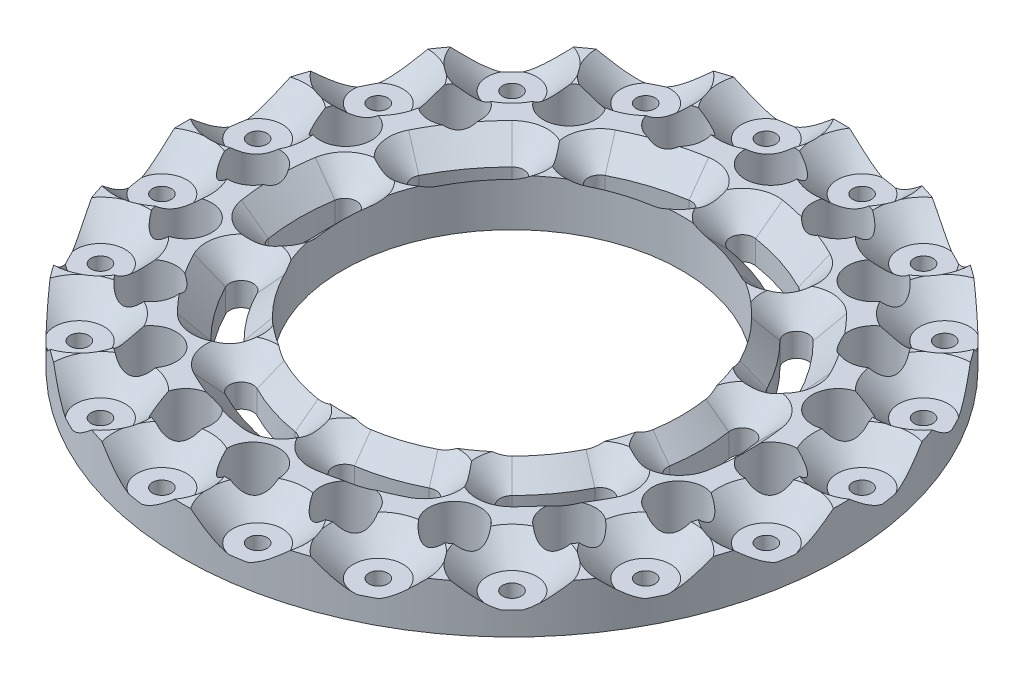
from build123d import *

# Parameters (mm, degrees)
SKETCH1_R           = 70
SKETCH1_R_2         = 5.5
SKETCH1_R_3         = 36
SKETCH1_R_4         = 2
BOSS_EXTRUDE1_DEPTH = 10
SKETCH3_R           = 5.25
CUT_EXTRUDE3_DEPTH  = 5
CHAMFER2_SIZE       = 5
CUT_EXTRUDE4_DEPTH  = 100.498743861
CHAMFER3_SIZE       = 5


with BuildPart() as part:
    # Sketch1 → Boss-Extrude1 (new body)
    with BuildSketch(Plane(origin=(0, 0, 0), x_dir=(1, 0, 0), z_dir=(0, 1, 0))):
        with Locations(Location((0, 0, 0), (0, 0, 270))):
            Circle(SKETCH1_R)
        with Locations(Location((55, 0, 0), (0, 0, 270))):
            Circle(SKETCH1_R_2, mode=Mode.SUBTRACT)
        with Locations(Location((52.308108396, -16.995934691, 0), (0, 0, 270))):
            Circle(SKETCH1_R_2, mode=Mode.SUBTRACT)
        with Locations(Location((44.495934691, -32.328188876, 0), (0, 0, 270))):
            Circle(SKETCH1_R_2, mode=Mode.SUBTRACT)
        with Locations(Location((32.328188876, -44.495934691, 0), (0, 0, 270))):
            Circle(SKETCH1_R_2, mode=Mode.SUBTRACT)
        with Locations(Location((16.995934691, -52.308108396, 0), (0, 0, 270))):
            Circle(SKETCH1_R_2, mode=Mode.SUBTRACT)
        with Locations(Location((0, -55, 0), (0, 0, 270))):
            Circle(SKETCH1_R_2, mode=Mode.SUBTRACT)
        with Locations(Location((-16.995934691, -52.308108396, 0), (0, 0, 270))):
            Circle(SKETCH1_R_2, mode=Mode.SUBTRACT)
        with Locations(Location((-32.328188876, -44.495934691, 0), (0, 0, 270))):
            Circle(SKETCH1_R_2, mode=Mode.SUBTRACT)
        with Locations(Location((-44.495934691, -32.328188876, 0), (0, 0, 270))):
            Circle(SKETCH1_R_2, mode=Mode.SUBTRACT)
        with Locations(Location((-52.308108396, -16.995934691, 0), (0, 0, 270))):
            Circle(SKETCH1_R_2, mode=Mode.SUBTRACT)
        with Locations(Location((-55, 0, 0), (0, 0, 270))):
            Circle(SKETCH1_R_2, mode=Mode.SUBTRACT)
        with Locations(Location((-52.308108396, 16.995934691, 0), (0, 0, 270))):
            Circle(SKETCH1_R_2, mode=Mode.SUBTRACT)
        with Locations(Location((-44.495934691, 32.328188876, 0), (0, 0, 270))):
            Circle(SKETCH1_R_2, mode=Mode.SUBTRACT)
        with Locations(Location((-32.328188876, 44.495934691, 0), (0, 0, 270))):
            Circle(SKETCH1_R_2, mode=Mode.SUBTRACT)
        with Locations(Location((-16.995934691, 52.308108396, 0), (0, 0, 270))):
            Circle(SKETCH1_R_2, mode=Mode.SUBTRACT)
        with Locations(Location((0, 55, 0), (0, 0, 270))):
            Circle(SKETCH1_R_2, mode=Mode.SUBTRACT)
        with Locations(Location((16.995934691, 52.308108396, 0), (0, 0, 270))):
            Circle(SKETCH1_R_2, mode=Mode.SUBTRACT)
        with Locations(Location((32.328188876, 44.495934691, 0), (0, 0, 270))):
            Circle(SKETCH1_R_2, mode=Mode.SUBTRACT)
        with Locations(Location((44.495934691, 32.328188876, 0), (0, 0, 270))):
            Circle(SKETCH1_R_2, mode=Mode.SUBTRACT)
        with Locations(Location((52.308108396, 16.995934691, 0), (0, 0, 270))):
            Circle(SKETCH1_R_2, mode=Mode.SUBTRACT)
        with Locations(Location((0, 0, 0), (0, 0, 270))):
            Circle(SKETCH1_R_3, mode=Mode.SUBTRACT)
        with Locations(Location((64.199742139, 10.168240228, 0), (0, 0, 270))):
            Circle(SKETCH1_R_4, mode=Mode.SUBTRACT)
        with Locations(Location((64.199742139, -10.168240228, 0), (0, 0, 270))):
            Circle(SKETCH1_R_4, mode=Mode.SUBTRACT)
        with Locations(Location((57.915424072, -29.509382483, 0), (0, 0, 270))):
            Circle(SKETCH1_R_4, mode=Mode.SUBTRACT)
        with Locations(Location((45.961940777, -45.961940777, 0), (0, 0, 270))):
            Circle(SKETCH1_R_4, mode=Mode.SUBTRACT)
        with Locations(Location((29.509382483, -57.915424072, 0), (0, 0, 270))):
            Circle(SKETCH1_R_4, mode=Mode.SUBTRACT)
        with Locations(Location((10.168240228, -64.199742139, 0), (0, 0, 270))):
            Circle(SKETCH1_R_4, mode=Mode.SUBTRACT)
        with Locations(Location((-10.168240228, -64.199742139, 0), (0, 0, 270))):
            Circle(SKETCH1_R_4, mode=Mode.SUBTRACT)
        with Locations(Location((-29.509382483, -57.915424072, 0), (0, 0, 270))):
            Circle(SKETCH1_R_4, mode=Mode.SUBTRACT)
        with Locations(Location((-45.961940777, -45.961940777, 0), (0, 0, 270))):
            Circle(SKETCH1_R_4, mode=Mode.SUBTRACT)
        with Locations(Location((-57.915424072, -29.509382483, 0), (0, 0, 270))):
            Circle(SKETCH1_R_4, mode=Mode.SUBTRACT)
        with Locations(Location((-64.199742139, -10.168240228, 0), (0, 0, 270))):
            Circle(SKETCH1_R_4, mode=Mode.SUBTRACT)
        with Locations(Location((-64.199742139, 10.168240228, 0), (0, 0, 270))):
            Circle(SKETCH1_R_4, mode=Mode.SUBTRACT)
        with Locations(Location((-57.915424072, 29.509382483, 0), (0, 0, 270))):
            Circle(SKETCH1_R_4, mode=Mode.SUBTRACT)
        with Locations(Location((-45.961940777, 45.961940777, 0), (0, 0, 270))):
            Circle(SKETCH1_R_4, mode=Mode.SUBTRACT)
        with Locations(Location((-29.509382483, 57.915424072, 0), (0, 0, 270))):
            Circle(SKETCH1_R_4, mode=Mode.SUBTRACT)
        with Locations(Location((-10.168240228, 64.199742139, 0), (0, 0, 270))):
            Circle(SKETCH1_R_4, mode=Mode.SUBTRACT)
        with Locations(Location((10.168240228, 64.199742139, 0), (0, 0, 270))):
            Circle(SKETCH1_R_4, mode=Mode.SUBTRACT)
        with Locations(Location((29.509382483, 57.915424072, 0), (0, 0, 270))):
            Circle(SKETCH1_R_4, mode=Mode.SUBTRACT)
        with Locations(Location((45.961940777, 45.961940777, 0), (0, 0, 270))):
            Circle(SKETCH1_R_4, mode=Mode.SUBTRACT)
        with Locations(Location((57.915424072, 29.509382483, 0), (0, 0, 270))):
            Circle(SKETCH1_R_4, mode=Mode.SUBTRACT)
    extrude(amount=BOSS_EXTRUDE1_DEPTH)

    # Sketch3 → Cut-Extrude3 (cut)
    with BuildSketch(Plane(origin=(0, 10, 0), x_dir=(1, 0, 0), z_dir=(0, 1, 0))):
        with Locations((-57.915424072, -29.509382483)):
            Circle(SKETCH3_R)
        with Locations((-64.199742139, -10.168240228)):
            Circle(SKETCH3_R)
        with Locations((-64.199742139, 10.168240228)):
            Circle(SKETCH3_R)
        with Locations((-57.915424072, 29.509382483)):
            Circle(SKETCH3_R)
        with Locations((-45.961940777, 45.961940777)):
            Circle(SKETCH3_R)
        with Locations((-29.509382483, 57.915424072)):
            Circle(SKETCH3_R)
        with Locations((-10.168240228, 64.199742139)):
            Circle(SKETCH3_R)
        with Locations((10.168240228, 64.199742139)):
            Circle(SKETCH3_R)
        with Locations((29.509382483, 57.915424072)):
            Circle(SKETCH3_R)
        with Locations((45.961940777, 45.961940777)):
            Circle(SKETCH3_R)
        with Locations((57.915424072, 29.509382483)):
            Circle(SKETCH3_R)
        with Locations((64.199742139, 10.168240228)):
            Circle(SKETCH3_R)
        with Locations((64.199742139, -10.168240228)):
            Circle(SKETCH3_R)
        with Locations((57.915424072, -29.509382483)):
            Circle(SKETCH3_R)
        with Locations((45.961940777, -45.961940777)):
            Circle(SKETCH3_R)
        with Locations((29.509382483, -57.915424072)):
            Circle(SKETCH3_R)
        with Locations((10.168240228, -64.199742139)):
            Circle(SKETCH3_R)
        with Locations((-10.168240228, -64.199742139)):
            Circle(SKETCH3_R)
        with Locations((-29.509382483, -57.915424072)):
            Circle(SKETCH3_R)
        with Locations((-45.961940777, -45.961940777)):
            Circle(SKETCH3_R)
    extrude(amount=-CUT_EXTRUDE3_DEPTH, mode=Mode.SUBTRACT)

    # Chamfer2
    # the kernel refuses this chamfer: 5 mm, written as the material it takes off along each edge
    with BuildSketch(Plane(origin=(-57.915424072, 10, 29.509382483), x_dir=(-0.8924283781234055, 0, 0.45118908444246325), z_dir=(0.45118908444246325, 0, 0.8924283781234055))) as chamfer2_piece_1_section:
        Polygon((5.25, CHAMFER2_SIZE), (5.25 + CHAMFER2_SIZE, 0), (5.25, 0), align=None)
    chamfer2_piece_1 = revolve(axis=Axis((-57.915424072, 10, 29.509382483), (0, -1, 0)), revolution_arc=359.64, mode=Mode.PRIVATE)
    chamfer2_piece_1 = split(chamfer2_piece_1, bisect_by=Plane(origin=(-51.000108994, 5, 25.985853459), z_dir=(0, 1, 0)), keep=Keep.TOP, mode=Mode.PRIVATE)
    add(chamfer2_piece_1, mode=Mode.SUBTRACT)
    with BuildSketch(Plane(origin=(-45.961940777, 10, 45.961940777), x_dir=(-0.7093247295722279, 0, 0.7048818539424077), z_dir=(0.7048818539424077, 0, 0.7093247295722279))) as chamfer2_piece_2_section:
        Polygon((5.25, CHAMFER2_SIZE), (5.25 + CHAMFER2_SIZE, 0), (5.25, 0), align=None)
    chamfer2_piece_2 = revolve(axis=Axis((-45.961940777, 10, 45.961940777), (0, -1, 0)), revolution_arc=359.64, mode=Mode.PRIVATE)
    chamfer2_piece_2 = split(chamfer2_piece_2, bisect_by=Plane(origin=(-40.473915658, 5, 40.473915658), z_dir=(0, 1, 0)), keep=Keep.TOP, mode=Mode.PRIVATE)
    add(chamfer2_piece_2, mode=Mode.SUBTRACT)
    with BuildSketch(Plane(origin=(-29.509382483, 10, 57.915424072), x_dir=(-0.45678743433478863, 0, 0.8895758763780868), z_dir=(0.8895758763780868, 0, 0.45678743433478863))) as chamfer2_piece_3_section:
        Polygon((5.25, CHAMFER2_SIZE), (5.25 + CHAMFER2_SIZE, 0), (5.25, 0), align=None)
    chamfer2_piece_3 = revolve(axis=Axis((-29.509382483, 10, 57.915424072), (0, -1, 0)), revolution_arc=359.64, mode=Mode.PRIVATE)
    chamfer2_piece_3 = split(chamfer2_piece_3, bisect_by=Plane(origin=(-25.985853459, 5, 51.000108994), z_dir=(0, 1, 0)), keep=Keep.TOP, mode=Mode.PRIVATE)
    add(chamfer2_piece_3, mode=Mode.SUBTRACT)
    with BuildSketch(Plane(origin=(-10.168240228, 10, 64.199742139), x_dir=(-0.15953660239825893, 0, 0.9871920139948559), z_dir=(0.9871920139948559, 0, 0.15953660239825893))) as chamfer2_piece_4_section:
        Polygon((5.25, CHAMFER2_SIZE), (5.25 + CHAMFER2_SIZE, 0), (5.25, 0), align=None)
    chamfer2_piece_4 = revolve(axis=Axis((-10.168240228, 10, 64.199742139), (0, -1, 0)), revolution_arc=359.64, mode=Mode.PRIVATE)
    chamfer2_piece_4 = split(chamfer2_piece_4, bisect_by=Plane(origin=(-8.95411487, 5, 56.534056322), z_dir=(0, 1, 0)), keep=Keep.TOP, mode=Mode.PRIVATE)
    add(chamfer2_piece_4, mode=Mode.SUBTRACT)
    with BuildSketch(Plane(origin=(10.168240228, 10, 64.199742139), x_dir=(0.15333078373687278, 0, 0.9881749191102942), z_dir=(0.9881749191102942, 0, -0.15333078373687278))) as chamfer2_piece_5_section:
        Polygon((5.25, CHAMFER2_SIZE), (5.25 + CHAMFER2_SIZE, 0), (5.25, 0), align=None)
    chamfer2_piece_5 = revolve(axis=Axis((10.168240228, 10, 64.199742139), (0, -1, 0)), revolution_arc=359.64, mode=Mode.PRIVATE)
    chamfer2_piece_5 = split(chamfer2_piece_5, bisect_by=Plane(origin=(8.95411487, 5, 56.534056323), z_dir=(0, 1, 0)), keep=Keep.TOP, mode=Mode.PRIVATE)
    add(chamfer2_piece_5, mode=Mode.SUBTRACT)
    with BuildSketch(Plane(origin=(29.509382483, 10, 57.915424072), x_dir=(0.45118908444246214, 0, 0.8924283781234059), z_dir=(0.8924283781234059, 0, -0.45118908444246214))) as chamfer2_piece_6_section:
        Polygon((5.25, CHAMFER2_SIZE), (5.25 + CHAMFER2_SIZE, 0), (5.25, 0), align=None)
    chamfer2_piece_6 = revolve(axis=Axis((29.509382483, 10, 57.915424072), (0, -1, 0)), revolution_arc=359.64, mode=Mode.PRIVATE)
    chamfer2_piece_6 = split(chamfer2_piece_6, bisect_by=Plane(origin=(25.985853459, 5, 51.000108994), z_dir=(0, 1, 0)), keep=Keep.TOP, mode=Mode.PRIVATE)
    add(chamfer2_piece_6, mode=Mode.SUBTRACT)
    with BuildSketch(Plane(origin=(45.961940777, 10, 45.961940777), x_dir=(0.7048818539424131, 0, 0.7093247295722225), z_dir=(0.7093247295722225, 0, -0.7048818539424131))) as chamfer2_piece_7_section:
        Polygon((5.25, CHAMFER2_SIZE), (5.25 + CHAMFER2_SIZE, 0), (5.25, 0), align=None)
    chamfer2_piece_7 = revolve(axis=Axis((45.961940777, 10, 45.961940777), (0, -1, 0)), revolution_arc=359.64, mode=Mode.PRIVATE)
    chamfer2_piece_7 = split(chamfer2_piece_7, bisect_by=Plane(origin=(40.473915658, 5, 40.473915658), z_dir=(0, 1, 0)), keep=Keep.TOP, mode=Mode.PRIVATE)
    add(chamfer2_piece_7, mode=Mode.SUBTRACT)
    with BuildSketch(Plane(origin=(57.915424072, 10, 29.509382483), x_dir=(0.8895758763780893, 0, 0.4567874343347838), z_dir=(0.4567874343347838, 0, -0.8895758763780893))) as chamfer2_piece_8_section:
        Polygon((5.25, CHAMFER2_SIZE), (5.25 + CHAMFER2_SIZE, 0), (5.25, 0), align=None)
    chamfer2_piece_8 = revolve(axis=Axis((57.915424072, 10, 29.509382483), (0, -1, 0)), revolution_arc=359.64, mode=Mode.PRIVATE)
    chamfer2_piece_8 = split(chamfer2_piece_8, bisect_by=Plane(origin=(51.000108995, 5, 25.98585346), z_dir=(0, 1, 0)), keep=Keep.TOP, mode=Mode.PRIVATE)
    add(chamfer2_piece_8, mode=Mode.SUBTRACT)
    with BuildSketch(Plane(origin=(64.199742139, 10, 10.168240228), x_dir=(0.9881749191103082, 0, 0.1533307837367822), z_dir=(-0.1533307837367822, 0, 0.9881749191103082))) as chamfer2_piece_9_section:
        Polygon((5.25, -CHAMFER2_SIZE), (5.25 + CHAMFER2_SIZE, 0), (5.25, 0), align=None)
    chamfer2_piece_9 = revolve(axis=Axis((64.199742139, 10, 10.168240228), (0, 1, 0)), revolution_arc=359.64, mode=Mode.PRIVATE)
    chamfer2_piece_9 = split(chamfer2_piece_9, bisect_by=Plane(origin=(56.534056323, 5, 8.95411487), z_dir=(0, 1, 0)), keep=Keep.TOP, mode=Mode.PRIVATE)
    add(chamfer2_piece_9, mode=Mode.SUBTRACT)
    with BuildSketch(Plane(origin=(64.199742139, 10, -10.168240228), x_dir=(0.9871920139948248, 0, -0.1595366023984519), z_dir=(0.1595366023984519, 0, 0.9871920139948248))) as chamfer2_piece_10_section:
        Polygon((5.25, -CHAMFER2_SIZE), (5.25 + CHAMFER2_SIZE, 0), (5.25, 0), align=None)
    chamfer2_piece_10 = revolve(axis=Axis((64.199742139, 10, -10.168240228), (0, 1, 0)), revolution_arc=359.64, mode=Mode.PRIVATE)
    chamfer2_piece_10 = split(chamfer2_piece_10, bisect_by=Plane(origin=(56.534056325, 5, -8.95411487), z_dir=(0, 1, 0)), keep=Keep.TOP, mode=Mode.PRIVATE)
    add(chamfer2_piece_10, mode=Mode.SUBTRACT)
    with BuildSketch(Plane(origin=(57.915424072, 10, -29.509382483), x_dir=(0.8924283781236121, 0, -0.4511890844420543), z_dir=(-0.4511890844420543, 0, -0.8924283781236121))) as chamfer2_piece_11_section:
        Polygon((5.25, CHAMFER2_SIZE), (5.25 + CHAMFER2_SIZE, 0), (5.25, 0), align=None)
    chamfer2_piece_11 = revolve(axis=Axis((57.915424072, 10, -29.509382483), (0, -1, 0)), revolution_arc=359.64, mode=Mode.PRIVATE)
    chamfer2_piece_11 = split(chamfer2_piece_11, bisect_by=Plane(origin=(51.000108997, 5, -25.985853461), z_dir=(0, 1, 0)), keep=Keep.TOP, mode=Mode.PRIVATE)
    add(chamfer2_piece_11, mode=Mode.SUBTRACT)
    with BuildSketch(Plane(origin=(45.961940777, 10, -45.961940777), x_dir=(0.7093247295722185, 0, -0.7048818539424171), z_dir=(-0.7048818539424171, 0, -0.7093247295722185))) as chamfer2_piece_12_section:
        Polygon((5.25, CHAMFER2_SIZE), (5.25 + CHAMFER2_SIZE, 0), (5.25, 0), align=None)
    chamfer2_piece_12 = revolve(axis=Axis((45.961940777, 10, -45.961940777), (0, -1, 0)), revolution_arc=359.64, mode=Mode.PRIVATE)
    chamfer2_piece_12 = split(chamfer2_piece_12, bisect_by=Plane(origin=(40.473915661, 5, -40.473915661), z_dir=(0, 1, 0)), keep=Keep.TOP, mode=Mode.PRIVATE)
    add(chamfer2_piece_12, mode=Mode.SUBTRACT)
    with BuildSketch(Plane(origin=(29.509382483, 10, -57.915424072), x_dir=(0.4567874343343713, 0, -0.8895758763783012), z_dir=(-0.8895758763783012, 0, -0.4567874343343713))) as chamfer2_piece_13_section:
        Polygon((5.25, CHAMFER2_SIZE), (5.25 + CHAMFER2_SIZE, 0), (5.25, 0), align=None)
    chamfer2_piece_13 = revolve(axis=Axis((29.509382483, 10, -57.915424072), (0, -1, 0)), revolution_arc=359.64, mode=Mode.PRIVATE)
    chamfer2_piece_13 = split(chamfer2_piece_13, bisect_by=Plane(origin=(25.985853459, 5, -51.000108993), z_dir=(0, 1, 0)), keep=Keep.TOP, mode=Mode.PRIVATE)
    add(chamfer2_piece_13, mode=Mode.SUBTRACT)
    with BuildSketch(Plane(origin=(10.168240228, 10, -64.199742139), x_dir=(0.15953660239824335, 0, -0.9871920139948585), z_dir=(-0.9871920139948585, 0, -0.15953660239824335))) as chamfer2_piece_14_section:
        Polygon((5.25, CHAMFER2_SIZE), (5.25 + CHAMFER2_SIZE, 0), (5.25, 0), align=None)
    chamfer2_piece_14 = revolve(axis=Axis((10.168240228, 10, -64.199742139), (0, -1, 0)), revolution_arc=359.64, mode=Mode.PRIVATE)
    chamfer2_piece_14 = split(chamfer2_piece_14, bisect_by=Plane(origin=(8.95411487, 5, -56.534056325), z_dir=(0, 1, 0)), keep=Keep.TOP, mode=Mode.PRIVATE)
    add(chamfer2_piece_14, mode=Mode.SUBTRACT)
    with BuildSketch(Plane(origin=(-10.168240228, 10, -64.199742139), x_dir=(-0.15333078373687148, 0, -0.9881749191102943), z_dir=(-0.9881749191102943, 0, 0.15333078373687148))) as chamfer2_piece_15_section:
        Polygon((5.25, CHAMFER2_SIZE), (5.25 + CHAMFER2_SIZE, 0), (5.25, 0), align=None)
    chamfer2_piece_15 = revolve(axis=Axis((-10.168240228, 10, -64.199742139), (0, -1, 0)), revolution_arc=359.64, mode=Mode.PRIVATE)
    chamfer2_piece_15 = split(chamfer2_piece_15, bisect_by=Plane(origin=(-8.95411487, 5, -56.534056323), z_dir=(0, 1, 0)), keep=Keep.TOP, mode=Mode.PRIVATE)
    add(chamfer2_piece_15, mode=Mode.SUBTRACT)
    with BuildSketch(Plane(origin=(-29.509382483, 10, -57.915424072), x_dir=(-0.4511890844420575, 0, -0.8924283781236104), z_dir=(-0.8924283781236104, 0, 0.4511890844420575))) as chamfer2_piece_16_section:
        Polygon((5.25, CHAMFER2_SIZE), (5.25 + CHAMFER2_SIZE, 0), (5.25, 0), align=None)
    chamfer2_piece_16 = revolve(axis=Axis((-29.509382483, 10, -57.915424072), (0, -1, 0)), revolution_arc=359.64, mode=Mode.PRIVATE)
    chamfer2_piece_16 = split(chamfer2_piece_16, bisect_by=Plane(origin=(-25.985853459, 5, -51.000108994), z_dir=(0, 1, 0)), keep=Keep.TOP, mode=Mode.PRIVATE)
    add(chamfer2_piece_16, mode=Mode.SUBTRACT)
    with BuildSketch(Plane(origin=(-45.961940777, 10, -45.961940777), x_dir=(-0.7048818539424184, 0, -0.709324729572217), z_dir=(-0.709324729572217, 0, 0.7048818539424184))) as chamfer2_piece_17_section:
        Polygon((5.25, CHAMFER2_SIZE), (5.25 + CHAMFER2_SIZE, 0), (5.25, 0), align=None)
    chamfer2_piece_17 = revolve(axis=Axis((-45.961940777, 10, -45.961940777), (0, -1, 0)), revolution_arc=359.64, mode=Mode.PRIVATE)
    chamfer2_piece_17 = split(chamfer2_piece_17, bisect_by=Plane(origin=(-40.473915658, 5, -40.473915658), z_dir=(0, 1, 0)), keep=Keep.TOP, mode=Mode.PRIVATE)
    add(chamfer2_piece_17, mode=Mode.SUBTRACT)
    with BuildSketch(Plane(origin=(-57.915424072, 10, -29.509382483), x_dir=(-0.8895758763780904, 0, -0.45678743433478164), z_dir=(-0.45678743433478164, 0, 0.8895758763780904))) as chamfer2_piece_18_section:
        Polygon((5.25, CHAMFER2_SIZE), (5.25 + CHAMFER2_SIZE, 0), (5.25, 0), align=None)
    chamfer2_piece_18 = revolve(axis=Axis((-57.915424072, 10, -29.509382483), (0, -1, 0)), revolution_arc=359.64, mode=Mode.PRIVATE)
    chamfer2_piece_18 = split(chamfer2_piece_18, bisect_by=Plane(origin=(-51.000108993, 5, -25.985853459), z_dir=(0, 1, 0)), keep=Keep.TOP, mode=Mode.PRIVATE)
    add(chamfer2_piece_18, mode=Mode.SUBTRACT)
    with BuildSketch(Plane(origin=(-64.199742139, 10, -10.168240228), x_dir=(-0.987192013994852, 0, -0.1595366023982832), z_dir=(-0.1595366023982832, 0, 0.987192013994852))) as chamfer2_piece_19_section:
        Polygon((5.25, CHAMFER2_SIZE), (5.25 + CHAMFER2_SIZE, 0), (5.25, 0), align=None)
    chamfer2_piece_19 = revolve(axis=Axis((-64.199742139, 10, -10.168240228), (0, -1, 0)), revolution_arc=359.64, mode=Mode.PRIVATE)
    chamfer2_piece_19 = split(chamfer2_piece_19, bisect_by=Plane(origin=(-56.534056323, 5, -8.95411487), z_dir=(0, 1, 0)), keep=Keep.TOP, mode=Mode.PRIVATE)
    add(chamfer2_piece_19, mode=Mode.SUBTRACT)
    with BuildSketch(Plane(origin=(-64.199742139, 10, 10.168240228), x_dir=(-0.9881749191102892, 0, 0.15333078373690406), z_dir=(0.15333078373690406, 0, 0.9881749191102892))) as chamfer2_piece_20_section:
        Polygon((5.25, CHAMFER2_SIZE), (5.25 + CHAMFER2_SIZE, 0), (5.25, 0), align=None)
    chamfer2_piece_20 = revolve(axis=Axis((-64.199742139, 10, 10.168240228), (0, -1, 0)), revolution_arc=359.64, mode=Mode.PRIVATE)
    chamfer2_piece_20 = split(chamfer2_piece_20, bisect_by=Plane(origin=(-56.534056323, 5, 8.95411487), z_dir=(0, 1, 0)), keep=Keep.TOP, mode=Mode.PRIVATE)
    add(chamfer2_piece_20, mode=Mode.SUBTRACT)

    # Sketch4 → Cut-Extrude4 (cut, through all)
    with BuildSketch(Plane(origin=(0, 10, 0), x_dir=(1, 0, 0), z_dir=(0, 1, 0))):
        with BuildLine():
            ThreePointArc((44.692897412, -7.078659543), (45.25, 0), (44.692897412, 7.078659543))
            ThreePointArc((44.692897412, 7.078659543), (41.832590398, 9.156794232), (39.754455709, 6.296487218))
            ThreePointArc((39.754455709, 6.296487218), (40.25, 0), (39.754455709, -6.296487218))
            ThreePointArc((39.754455709, -6.296487218), (41.832590398, -9.156794232), (44.692897412, -7.078659543))
        make_face()
        with BuildLine():
            ThreePointArc((31.996581849, -31.996581849), (36.608018995, -26.597282666), (40.31804522, -20.543070113))
            ThreePointArc((40.31804522, -20.543070113), (39.225505158, -17.180577553), (35.863012599, -18.273117615))
            ThreePointArc((35.863012599, -18.273117615), (32.562934024, -23.658356405), (28.461047943, -28.461047943))
            ThreePointArc((28.461047943, -28.461047943), (28.461047943, -31.996581849), (31.996581849, -31.996581849))
        make_face()
        with BuildLine():
            ThreePointArc((7.078659543, -44.692897412), (13.983018995, -43.035307362), (20.543070113, -40.31804522))
            ThreePointArc((20.543070113, -40.31804522), (21.635610174, -36.95555266), (18.273117615, -35.863012599))
            ThreePointArc((18.273117615, -35.863012599), (12.437934024, -38.280024781), (6.296487218, -39.754455709))
            ThreePointArc((6.296487218, -39.754455709), (4.218352529, -42.614762723), (7.078659543, -44.692897412))
        make_face()
        with BuildLine():
            ThreePointArc((-20.543070113, -40.31804522), (-13.983018995, -43.035307362), (-7.078659543, -44.692897412))
            ThreePointArc((-7.078659543, -44.692897412), (-4.218352529, -42.614762723), (-6.296487218, -39.754455709))
            ThreePointArc((-6.296487218, -39.754455709), (-12.437934024, -38.280024781), (-18.273117615, -35.863012599))
            ThreePointArc((-18.273117615, -35.863012599), (-21.635610174, -36.95555266), (-20.543070113, -40.31804522))
        make_face()
        with BuildLine():
            ThreePointArc((-40.31804522, -20.543070113), (-36.608018995, -26.597282666), (-31.996581849, -31.996581849))
            ThreePointArc((-31.996581849, -31.996581849), (-28.461047943, -31.996581849), (-28.461047943, -28.461047943))
            ThreePointArc((-28.461047943, -28.461047943), (-32.562934024, -23.658356405), (-35.863012599, -18.273117615))
            ThreePointArc((-35.863012599, -18.273117615), (-39.225505158, -17.180577553), (-40.31804522, -20.543070113))
        make_face()
        with BuildLine():
            ThreePointArc((-31.996581849, 31.996581849), (-36.608018995, 26.597282666), (-40.31804522, 20.543070113))
            ThreePointArc((-40.31804522, 20.543070113), (-39.225505158, 17.180577553), (-35.863012599, 18.273117615))
            ThreePointArc((-35.863012599, 18.273117615), (-32.562934024, 23.658356405), (-28.461047943, 28.461047943))
            ThreePointArc((-28.461047943, 28.461047943), (-28.461047943, 31.996581849), (-31.996581849, 31.996581849))
        make_face()
        with BuildLine():
            ThreePointArc((-7.078659543, 44.692897412), (-13.983018995, 43.035307362), (-20.543070113, 40.31804522))
            ThreePointArc((-20.543070113, 40.31804522), (-21.635610174, 36.95555266), (-18.273117615, 35.863012599))
            ThreePointArc((-18.273117615, 35.863012599), (-12.437934024, 38.280024781), (-6.296487218, 39.754455709))
            ThreePointArc((-6.296487218, 39.754455709), (-4.218352529, 42.614762723), (-7.078659543, 44.692897412))
        make_face()
        with BuildLine():
            ThreePointArc((20.543070113, 40.31804522), (13.983018995, 43.035307362), (7.078659543, 44.692897412))
            ThreePointArc((7.078659543, 44.692897412), (4.218352529, 42.614762723), (6.296487218, 39.754455709))
            ThreePointArc((6.296487218, 39.754455709), (12.437934024, 38.280024781), (18.273117615, 35.863012599))
            ThreePointArc((18.273117615, 35.863012599), (21.635610174, 36.95555266), (20.543070113, 40.31804522))
        make_face()
        with BuildLine():
            ThreePointArc((40.31804522, 20.543070113), (36.608018995, 26.597282666), (31.996581849, 31.996581849))
            ThreePointArc((31.996581849, 31.996581849), (28.461047943, 31.996581849), (28.461047943, 28.461047943))
            ThreePointArc((28.461047943, 28.461047943), (32.562934024, 23.658356405), (35.863012599, 18.273117615))
            ThreePointArc((35.863012599, 18.273117615), (39.225505158, 17.180577553), (40.31804522, 20.543070113))
        make_face()
        with BuildLine():
            ThreePointArc((-39.754455709, 6.296487218), (-40.25, 0), (-39.754455709, -6.296487218))
            ThreePointArc((-39.754455709, -6.296487218), (-41.832590398, -9.156794232), (-44.692897412, -7.078659543))
            ThreePointArc((-44.692897412, -7.078659543), (-45.25, 0), (-44.692897412, 7.078659543))
            ThreePointArc((-44.692897412, 7.078659543), (-41.832590398, 9.156794232), (-39.754455709, 6.296487218))
        make_face()
    extrude(amount=-CUT_EXTRUDE4_DEPTH, mode=Mode.SUBTRACT)

    # Chamfer3
    # the kernel refuses this chamfer: 5 mm, written as the material it takes off along each edge
    with BuildSketch(Plane(origin=(0, 10, 0), x_dir=(0.891006524188359, 0, 0.4539904997395641), z_dir=(0.4539904997395641, 0, -0.891006524188359))) as chamfer3_piece_1:
        Polygon((40.25, CHAMFER3_SIZE), (40.25 - CHAMFER3_SIZE, 0), (40.25, 0), align=None)
    chamfer3_piece_1_solid = revolve(axis=Axis((0, 10, 0), (0, -1, 0)), revolution_arc=18, mode=Mode.PRIVATE)
    with BuildSketch(Plane(origin=(0, 10, 0), x_dir=(0.7071067811865483, 0, 0.7071067811865468), z_dir=(-0.7071067811865468, 0, 0.7071067811865483))) as chamfer3_piece_2:
        Polygon((45.25, -CHAMFER3_SIZE), (45.25 + CHAMFER3_SIZE, 0), (45.25, 0), align=None)
    chamfer3_piece_2_solid = revolve(axis=Axis((0, 10, 0), (0, 1, 0)), revolution_arc=18, mode=Mode.PRIVATE)
    with BuildSketch(Plane(origin=(38.090528909, 10, 19.408093864), x_dir=(0.8910065241883613, 0, 0.45399049973955946), z_dir=(-0.45399049973955946, 0, 0.8910065241883613))) as chamfer3_piece_3:
        Polygon((2.5, -CHAMFER3_SIZE), (2.5 + CHAMFER3_SIZE, 0), (2.5, 0), align=None)
    chamfer3_piece_3_solid = revolve(axis=Axis((38.090528909, 10, 19.408093864), (0, 1, 0)), revolution_arc=180, mode=Mode.PRIVATE)
    with BuildSketch(Plane(origin=(30.228814896, 10, 30.228814896), x_dir=(-0.7071067811865476, 0, -0.7071067811865476), z_dir=(0.7071067811865476, 0, -0.7071067811865476))) as chamfer3_piece_4:
        Polygon((2.5, -CHAMFER3_SIZE), (2.5 + CHAMFER3_SIZE, 0), (2.5, 0), align=None)
    chamfer3_piece_4_solid = revolve(axis=Axis((30.228814896, 10, 30.228814896), (0, 1, 0)), revolution_arc=180, mode=Mode.PRIVATE)
    with BuildSketch(Plane(origin=(0, 10, 0), x_dir=(0.45399049973952726, 0, 0.8910065241883779), z_dir=(0.8910065241883779, 0, -0.45399049973952726))) as chamfer3_piece_5:
        Polygon((40.25, CHAMFER3_SIZE), (40.25 - CHAMFER3_SIZE, 0), (40.25, 0), align=None)
    chamfer3_piece_5_solid = revolve(axis=Axis((0, 10, 0), (0, -1, 0)), revolution_arc=18, mode=Mode.PRIVATE)
    with BuildSketch(Plane(origin=(0, 10, 0), x_dir=(0.1564344650402346, 0, 0.9876883405951372), z_dir=(-0.9876883405951372, 0, 0.1564344650402346))) as chamfer3_piece_6:
        Polygon((45.25, -CHAMFER3_SIZE), (45.25 + CHAMFER3_SIZE, 0), (45.25, 0), align=None)
    chamfer3_piece_6_solid = revolve(axis=Axis((0, 10, 0), (0, 1, 0)), revolution_arc=18, mode=Mode.PRIVATE)
    with BuildSketch(Plane(origin=(19.408093864, 10, 38.090528909), x_dir=(0.4539904997395312, 0, 0.8910065241883759), z_dir=(-0.8910065241883759, 0, 0.4539904997395312))) as chamfer3_piece_7:
        Polygon((2.5, -CHAMFER3_SIZE), (2.5 + CHAMFER3_SIZE, 0), (2.5, 0), align=None)
    chamfer3_piece_7_solid = revolve(axis=Axis((19.408093864, 10, 38.090528909), (0, 1, 0)), revolution_arc=180, mode=Mode.PRIVATE)
    with BuildSketch(Plane(origin=(6.68757338, 10, 42.22367656), x_dir=(-0.15643446504022854, 0, -0.987688340595138), z_dir=(0.987688340595138, 0, -0.15643446504022854))) as chamfer3_piece_8:
        Polygon((2.5, -CHAMFER3_SIZE), (2.5 + CHAMFER3_SIZE, 0), (2.5, 0), align=None)
    chamfer3_piece_8_solid = revolve(axis=Axis((6.68757338, 10, 42.22367656), (0, 1, 0)), revolution_arc=180, mode=Mode.PRIVATE)
    with BuildSketch(Plane(origin=(0, 10, 0), x_dir=(-0.15643446504025288, 0, 0.9876883405951342), z_dir=(0.9876883405951342, 0, 0.15643446504025288))) as chamfer3_piece_9:
        Polygon((40.25, CHAMFER3_SIZE), (40.25 - CHAMFER3_SIZE, 0), (40.25, 0), align=None)
    chamfer3_piece_9_solid = revolve(axis=Axis((0, 10, 0), (0, -1, 0)), revolution_arc=18, mode=Mode.PRIVATE)
    with BuildSketch(Plane(origin=(0, 10, 0), x_dir=(-0.45399049973954747, 0, 0.8910065241883676), z_dir=(-0.8910065241883676, 0, -0.45399049973954747))) as chamfer3_piece_10:
        Polygon((45.25, -CHAMFER3_SIZE), (45.25 + CHAMFER3_SIZE, 0), (45.25, 0), align=None)
    chamfer3_piece_10_solid = revolve(axis=Axis((0, 10, 0), (0, 1, 0)), revolution_arc=18, mode=Mode.PRIVATE)
    with BuildSketch(Plane(origin=(-6.68757338, 10, 42.22367656), x_dir=(-0.15643446504024633, 0, 0.9876883405951353), z_dir=(-0.9876883405951353, 0, -0.15643446504024633))) as chamfer3_piece_11:
        Polygon((2.5, -CHAMFER3_SIZE), (2.5 + CHAMFER3_SIZE, 0), (2.5, 0), align=None)
    chamfer3_piece_11_solid = revolve(axis=Axis((-6.68757338, 10, 42.22367656), (0, 1, 0)), revolution_arc=180, mode=Mode.PRIVATE)
    with BuildSketch(Plane(origin=(-19.408093864, 10, 38.090528909), x_dir=(0.4539904997395516, 0, -0.8910065241883655), z_dir=(0.8910065241883655, 0, 0.4539904997395516))) as chamfer3_piece_12:
        Polygon((2.5, -CHAMFER3_SIZE), (2.5 + CHAMFER3_SIZE, 0), (2.5, 0), align=None)
    chamfer3_piece_12_solid = revolve(axis=Axis((-19.408093864, 10, 38.090528909), (0, 1, 0)), revolution_arc=180, mode=Mode.PRIVATE)
    with BuildSketch(Plane(origin=(0, 10, 0), x_dir=(-0.7071067811865654, 0, 0.7071067811865296), z_dir=(0.7071067811865296, 0, 0.7071067811865654))) as chamfer3_piece_13:
        Polygon((40.25, CHAMFER3_SIZE), (40.25 - CHAMFER3_SIZE, 0), (40.25, 0), align=None)
    chamfer3_piece_13_solid = revolve(axis=Axis((0, 10, 0), (0, -1, 0)), revolution_arc=18, mode=Mode.PRIVATE)
    with BuildSketch(Plane(origin=(0, 10, 0), x_dir=(-0.8910065241883692, 0, 0.45399049973954403), z_dir=(-0.45399049973954403, 0, -0.8910065241883692))) as chamfer3_piece_14:
        Polygon((45.25, -CHAMFER3_SIZE), (45.25 + CHAMFER3_SIZE, 0), (45.25, 0), align=None)
    chamfer3_piece_14_solid = revolve(axis=Axis((0, 10, 0), (0, 1, 0)), revolution_arc=18, mode=Mode.PRIVATE)
    with BuildSketch(Plane(origin=(-30.228814896, 10, 30.228814896), x_dir=(-0.707106781186561, 0, 0.707106781186534), z_dir=(-0.707106781186534, 0, -0.707106781186561))) as chamfer3_piece_15:
        Polygon((2.5, -CHAMFER3_SIZE), (2.5 + CHAMFER3_SIZE, 0), (2.5, 0), align=None)
    chamfer3_piece_15_solid = revolve(axis=Axis((-30.228814896, 10, 30.228814896), (0, 1, 0)), revolution_arc=180, mode=Mode.PRIVATE)
    with BuildSketch(Plane(origin=(-38.090528909, 10, 19.408093864), x_dir=(0.89100652418837, 0, -0.4539904997395425), z_dir=(0.4539904997395425, 0, 0.89100652418837))) as chamfer3_piece_16:
        Polygon((2.5, -CHAMFER3_SIZE), (2.5 + CHAMFER3_SIZE, 0), (2.5, 0), align=None)
    chamfer3_piece_16_solid = revolve(axis=Axis((-38.090528909, 10, 19.408093864), (0, 1, 0)), revolution_arc=180, mode=Mode.PRIVATE)
    with BuildSketch(Plane(origin=(0, 10, 0), x_dir=(-0.8910065241883646, 0, -0.45399049973955297), z_dir=(-0.45399049973955297, 0, 0.8910065241883646))) as chamfer3_piece_17:
        Polygon((40.25, CHAMFER3_SIZE), (40.25 - CHAMFER3_SIZE, 0), (40.25, 0), align=None)
    chamfer3_piece_17_solid = revolve(axis=Axis((0, 10, 0), (0, -1, 0)), revolution_arc=18, mode=Mode.PRIVATE)
    with BuildSketch(Plane(origin=(0, 10, 0), x_dir=(-0.7071067811865471, 0, -0.7071067811865479), z_dir=(0.7071067811865479, 0, -0.7071067811865471))) as chamfer3_piece_18:
        Polygon((45.25, -CHAMFER3_SIZE), (45.25 + CHAMFER3_SIZE, 0), (45.25, 0), align=None)
    chamfer3_piece_18_solid = revolve(axis=Axis((0, 10, 0), (0, 1, 0)), revolution_arc=18, mode=Mode.PRIVATE)
    with BuildSketch(Plane(origin=(-38.090528909, 10, -19.408093864), x_dir=(-0.8910065241883625, 0, -0.4539904997395572), z_dir=(0.4539904997395572, 0, -0.8910065241883625))) as chamfer3_piece_19:
        Polygon((2.5, -CHAMFER3_SIZE), (2.5 + CHAMFER3_SIZE, 0), (2.5, 0), align=None)
    chamfer3_piece_19_solid = revolve(axis=Axis((-38.090528909, 10, -19.408093864), (0, 1, 0)), revolution_arc=180, mode=Mode.PRIVATE)
    with BuildSketch(Plane(origin=(-30.228814896, 10, -30.228814896), x_dir=(0.7071067811865518, 0, 0.7071067811865432), z_dir=(-0.7071067811865432, 0, 0.7071067811865518))) as chamfer3_piece_20:
        Polygon((2.5, -CHAMFER3_SIZE), (2.5 + CHAMFER3_SIZE, 0), (2.5, 0), align=None)
    chamfer3_piece_20_solid = revolve(axis=Axis((-30.228814896, 10, -30.228814896), (0, 1, 0)), revolution_arc=180, mode=Mode.PRIVATE)
    with BuildSketch(Plane(origin=(0, 10, 0), x_dir=(-0.45399049973954225, 0, -0.8910065241883701), z_dir=(-0.8910065241883701, 0, 0.45399049973954225))) as chamfer3_piece_21:
        Polygon((40.25, CHAMFER3_SIZE), (40.25 - CHAMFER3_SIZE, 0), (40.25, 0), align=None)
    chamfer3_piece_21_solid = revolve(axis=Axis((0, 10, 0), (0, -1, 0)), revolution_arc=18, mode=Mode.PRIVATE)
    with BuildSketch(Plane(origin=(0, 10, 0), x_dir=(-0.15643446504022943, 0, -0.987688340595138), z_dir=(0.987688340595138, 0, -0.15643446504022943))) as chamfer3_piece_22:
        Polygon((45.25, -CHAMFER3_SIZE), (45.25 + CHAMFER3_SIZE, 0), (45.25, 0), align=None)
    chamfer3_piece_22_solid = revolve(axis=Axis((0, 10, 0), (0, 1, 0)), revolution_arc=18, mode=Mode.PRIVATE)
    with BuildSketch(Plane(origin=(-19.408093864, 10, -38.090528909), x_dir=(-0.4539904997395403, 0, -0.8910065241883712), z_dir=(0.8910065241883712, 0, -0.4539904997395403))) as chamfer3_piece_23:
        Polygon((2.5, -CHAMFER3_SIZE), (2.5 + CHAMFER3_SIZE, 0), (2.5, 0), align=None)
    chamfer3_piece_23_solid = revolve(axis=Axis((-19.408093864, 10, -38.090528909), (0, 1, 0)), revolution_arc=180, mode=Mode.PRIVATE)
    with BuildSketch(Plane(origin=(-6.68757338, 10, -42.22367656), x_dir=(0.15643446504023548, 0, 0.987688340595137), z_dir=(-0.987688340595137, 0, 0.15643446504023548))) as chamfer3_piece_24:
        Polygon((2.5, -CHAMFER3_SIZE), (2.5 + CHAMFER3_SIZE, 0), (2.5, 0), align=None)
    chamfer3_piece_24_solid = revolve(axis=Axis((-6.68757338, 10, -42.22367656), (0, 1, 0)), revolution_arc=180, mode=Mode.PRIVATE)
    with BuildSketch(Plane(origin=(0, 10, 0), x_dir=(0.15643446504023786, 0, -0.9876883405951365), z_dir=(-0.9876883405951365, 0, -0.15643446504023786))) as chamfer3_piece_25:
        Polygon((40.25, CHAMFER3_SIZE), (40.25 - CHAMFER3_SIZE, 0), (40.25, 0), align=None)
    chamfer3_piece_25_solid = revolve(axis=Axis((0, 10, 0), (0, -1, 0)), revolution_arc=18, mode=Mode.PRIVATE)
    with BuildSketch(Plane(origin=(0, 10, 0), x_dir=(0.4539904997395492, 0, -0.8910065241883667), z_dir=(0.8910065241883667, 0, 0.4539904997395492))) as chamfer3_piece_26:
        Polygon((45.25, -CHAMFER3_SIZE), (45.25 + CHAMFER3_SIZE, 0), (45.25, 0), align=None)
    chamfer3_piece_26_solid = revolve(axis=Axis((0, 10, 0), (0, 1, 0)), revolution_arc=18, mode=Mode.PRIVATE)
    with BuildSketch(Plane(origin=(6.68757338, 10, -42.22367656), x_dir=(0.15643446504024122, 0, -0.987688340595136), z_dir=(0.987688340595136, 0, 0.15643446504024122))) as chamfer3_piece_27:
        Polygon((2.5, -CHAMFER3_SIZE), (2.5 + CHAMFER3_SIZE, 0), (2.5, 0), align=None)
    chamfer3_piece_27_solid = revolve(axis=Axis((6.68757338, 10, -42.22367656), (0, 1, 0)), revolution_arc=180, mode=Mode.PRIVATE)
    with BuildSketch(Plane(origin=(19.408093864, 10, -38.090528909), x_dir=(-0.4539904997395436, 0, 0.8910065241883693), z_dir=(-0.8910065241883693, 0, -0.4539904997395436))) as chamfer3_piece_28:
        Polygon((2.5, -CHAMFER3_SIZE), (2.5 + CHAMFER3_SIZE, 0), (2.5, 0), align=None)
    chamfer3_piece_28_solid = revolve(axis=Axis((19.408093864, 10, -38.090528909), (0, 1, 0)), revolution_arc=180, mode=Mode.PRIVATE)
    with BuildSketch(Plane(origin=(0, 10, 0), x_dir=(0.7071067811865547, 0, -0.7071067811865405), z_dir=(-0.7071067811865405, 0, -0.7071067811865547))) as chamfer3_piece_29:
        Polygon((40.25, CHAMFER3_SIZE), (40.25 - CHAMFER3_SIZE, 0), (40.25, 0), align=None)
    chamfer3_piece_29_solid = revolve(axis=Axis((0, 10, 0), (0, -1, 0)), revolution_arc=18, mode=Mode.PRIVATE)
    with BuildSketch(Plane(origin=(0, 10, 0), x_dir=(0.8910065241883692, 0, -0.4539904997395441), z_dir=(0.4539904997395441, 0, 0.8910065241883692))) as chamfer3_piece_30:
        Polygon((45.25, -CHAMFER3_SIZE), (45.25 + CHAMFER3_SIZE, 0), (45.25, 0), align=None)
    chamfer3_piece_30_solid = revolve(axis=Axis((0, 10, 0), (0, 1, 0)), revolution_arc=18, mode=Mode.PRIVATE)
    with BuildSketch(Plane(origin=(30.228814896, 10, -30.228814896), x_dir=(0.7071067811865568, 0, -0.7071067811865382), z_dir=(0.7071067811865382, 0, 0.7071067811865568))) as chamfer3_piece_31:
        Polygon((2.5, -CHAMFER3_SIZE), (2.5 + CHAMFER3_SIZE, 0), (2.5, 0), align=None)
    chamfer3_piece_31_solid = revolve(axis=Axis((30.228814896, 10, -30.228814896), (0, 1, 0)), revolution_arc=180, mode=Mode.PRIVATE)
    with BuildSketch(Plane(origin=(38.090528909, 10, -19.408093864), x_dir=(-0.8910065241883671, 0, 0.4539904997395482), z_dir=(-0.4539904997395482, 0, -0.8910065241883671))) as chamfer3_piece_32:
        Polygon((2.5, -CHAMFER3_SIZE), (2.5 + CHAMFER3_SIZE, 0), (2.5, 0), align=None)
    chamfer3_piece_32_solid = revolve(axis=Axis((38.090528909, 10, -19.408093864), (0, 1, 0)), revolution_arc=180, mode=Mode.PRIVATE)
    with BuildSketch(Plane(origin=(0, 10, 0), x_dir=(-0.9876883405951388, 0, -0.15643446504022468), z_dir=(0.15643446504022468, 0, -0.9876883405951388))) as chamfer3_piece_33:
        Polygon((40.25, -CHAMFER3_SIZE), (40.25 - CHAMFER3_SIZE, 0), (40.25, 0), align=None)
    chamfer3_piece_33_solid = revolve(axis=Axis((0, 10, 0), (0, 1, 0)), revolution_arc=18, mode=Mode.PRIVATE)
    with BuildSketch(Plane(origin=(-42.22367656, 10, -6.68757338), x_dir=(-0.9876883405951388, 0, -0.15643446504022476), z_dir=(-0.15643446504022476, 0, 0.9876883405951388))) as chamfer3_piece_34:
        Polygon((2.5, CHAMFER3_SIZE), (2.5 + CHAMFER3_SIZE, 0), (2.5, 0), align=None)
    chamfer3_piece_34_solid = revolve(axis=Axis((-42.22367656, 10, -6.68757338), (0, -1, 0)), revolution_arc=180, mode=Mode.PRIVATE)
    with BuildSketch(Plane(origin=(0, 10, 0), x_dir=(-0.9876883405951387, 0, 0.156434465040225), z_dir=(0.156434465040225, 0, 0.9876883405951387))) as chamfer3_piece_35:
        Polygon((45.25, CHAMFER3_SIZE), (45.25 + CHAMFER3_SIZE, 0), (45.25, 0), align=None)
    chamfer3_piece_35_solid = revolve(axis=Axis((0, 10, 0), (0, -1, 0)), revolution_arc=18, mode=Mode.PRIVATE)
    with BuildSketch(Plane(origin=(-42.22367656, 10, 6.68757338), x_dir=(0.9876883405951389, 0, -0.1564344650402237), z_dir=(-0.1564344650402237, 0, -0.9876883405951389))) as chamfer3_piece_36:
        Polygon((2.5, CHAMFER3_SIZE), (2.5 + CHAMFER3_SIZE, 0), (2.5, 0), align=None)
    chamfer3_piece_36_solid = revolve(axis=Axis((-42.22367656, 10, 6.68757338), (0, -1, 0)), revolution_arc=180, mode=Mode.PRIVATE)
    with BuildSketch(Plane(origin=(0, 10, 0), x_dir=(0.9876883405951399, 0, -0.15643446504021738), z_dir=(-0.15643446504021738, 0, -0.9876883405951399))) as chamfer3_piece_37:
        Polygon((40.25, CHAMFER3_SIZE), (40.25 - CHAMFER3_SIZE, 0), (40.25, 0), align=None)
    chamfer3_piece_37_solid = revolve(axis=Axis((0, 10, 0), (0, -1, 0)), revolution_arc=18, mode=Mode.PRIVATE)
    with BuildSketch(Plane(origin=(0, 10, 0), x_dir=(0.987688340595138, 0, 0.15643446504022968), z_dir=(-0.15643446504022968, 0, 0.987688340595138))) as chamfer3_piece_38:
        Polygon((45.25, -CHAMFER3_SIZE), (45.25 + CHAMFER3_SIZE, 0), (45.25, 0), align=None)
    chamfer3_piece_38_solid = revolve(axis=Axis((0, 10, 0), (0, 1, 0)), revolution_arc=18, mode=Mode.PRIVATE)
    with BuildSketch(Plane(origin=(42.22367656, 10, -6.68757338), x_dir=(0.9876883405951394, 0, -0.15643446504021988), z_dir=(0.15643446504021988, 0, 0.9876883405951394))) as chamfer3_piece_39:
        Polygon((2.5, -CHAMFER3_SIZE), (2.5 + CHAMFER3_SIZE, 0), (2.5, 0), align=None)
    chamfer3_piece_39_solid = revolve(axis=Axis((42.22367656, 10, -6.68757338), (0, 1, 0)), revolution_arc=180, mode=Mode.PRIVATE)
    with BuildSketch(Plane(origin=(42.22367656, 10, 6.68757338), x_dir=(-0.9876883405951379, 0, -0.1564344650402296), z_dir=(0.1564344650402296, 0, -0.9876883405951379))) as chamfer3_piece_40:
        Polygon((2.5, -CHAMFER3_SIZE), (2.5 + CHAMFER3_SIZE, 0), (2.5, 0), align=None)
    chamfer3_piece_40_solid = revolve(axis=Axis((42.22367656, 10, 6.68757338), (0, 1, 0)), revolution_arc=180, mode=Mode.PRIVATE)
    add([chamfer3_piece_1_solid, chamfer3_piece_2_solid, chamfer3_piece_3_solid, chamfer3_piece_4_solid, chamfer3_piece_5_solid, chamfer3_piece_6_solid, chamfer3_piece_7_solid, chamfer3_piece_8_solid, chamfer3_piece_9_solid, chamfer3_piece_10_solid, chamfer3_piece_11_solid, chamfer3_piece_12_solid, chamfer3_piece_13_solid, chamfer3_piece_14_solid, chamfer3_piece_15_solid, chamfer3_piece_16_solid, chamfer3_piece_17_solid, chamfer3_piece_18_solid, chamfer3_piece_19_solid, chamfer3_piece_20_solid, chamfer3_piece_21_solid, chamfer3_piece_22_solid, chamfer3_piece_23_solid, chamfer3_piece_24_solid, chamfer3_piece_25_solid, chamfer3_piece_26_solid, chamfer3_piece_27_solid, chamfer3_piece_28_solid, chamfer3_piece_29_solid, chamfer3_piece_30_solid, chamfer3_piece_31_solid, chamfer3_piece_32_solid, chamfer3_piece_33_solid, chamfer3_piece_34_solid, chamfer3_piece_35_solid, chamfer3_piece_36_solid, chamfer3_piece_37_solid, chamfer3_piece_38_solid, chamfer3_piece_39_solid, chamfer3_piece_40_solid], mode=Mode.SUBTRACT)


solid = part.part
